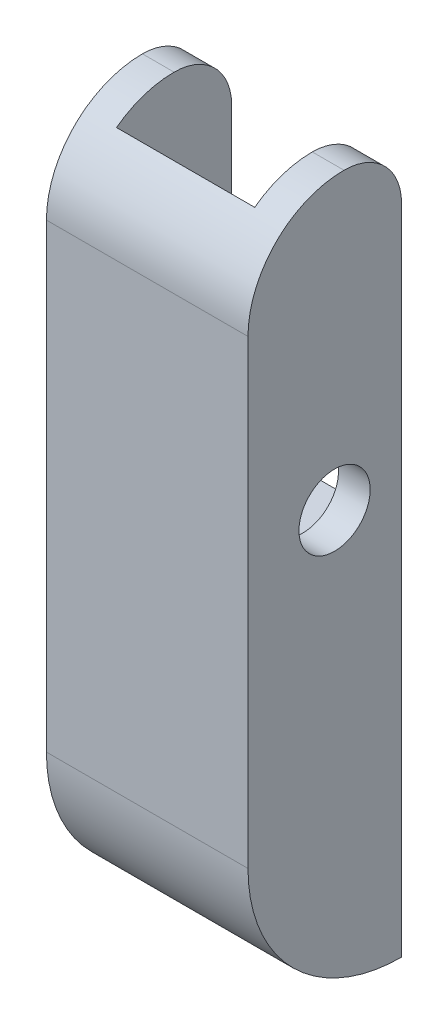
from build123d import *

# Parameters (mm, degrees)
SKETCH1_W               = 13.335
SKETCH1_H               = 46.99
BOSS_EXTRUDE1_DEPTH     = 10.16
FILLET5_R               = 3.81
SKETCH2_W               = 9.144
SKETCH2_H               = 22.352
CUT_EXTRUDE1_DEPTH      = 7.62
CUT_EXTRUDE2_DEPTH      = 50.890960354
CUT_EXTRUDE2_DEPTH_BACK = 50.890960354
SKETCH3_R               = 2.35585
FILLET4_R               = 6.35
FILLET6_R               = 10.16


# Some blends are built 0.0001 mm under size
with BuildPart() as part:
    # Sketch1 → Boss-Extrude1 (new body)
    with BuildSketch(Plane.XY):
        with Locations((6.6675, 23.495)):
            Rectangle(SKETCH1_W, SKETCH1_H)
    extrude(amount=BOSS_EXTRUDE1_DEPTH)

    # Fillet5
    fillet5_edges = [part.edges().sort_by_distance(p)[0] for p in [
        (6.6675, 46.99, 0),
    ]]
    fillet(fillet5_edges, radius=FILLET5_R)

    # Sketch2 → Cut-Extrude1 (cut)
    with BuildSketch(Plane(origin=(0, 0, 0), x_dir=(-1, 0, 0), z_dir=(0, 0, -1))):
        with Locations((-6.6675, 35.814)):
            Rectangle(SKETCH2_W, SKETCH2_H)
    extrude(amount=-CUT_EXTRUDE1_DEPTH, mode=Mode.SUBTRACT)

    # Sketch3 → Cut-Extrude2 (cut, two sides: drawn at the far end of the back side and taken through both)
    with BuildSketch(Plane.ZY.offset(-CUT_EXTRUDE2_DEPTH_BACK)):
        with Locations((4.4323, 27.8257)):
            Circle(SKETCH3_R)
    extrude(amount=CUT_EXTRUDE2_DEPTH + CUT_EXTRUDE2_DEPTH_BACK, mode=Mode.SUBTRACT)

    # Fillet4
    # the kernel refuses this fillet: 6.35 mm, written as the material it takes off along each edge
    with BuildSketch(Plane(origin=(29.21, 46.99, 10.16), x_dir=(0, 0, -1), z_dir=(-1, 0, 0))) as fillet4_piece_1:
        with BuildLine():
            CenterArc((FILLET4_R, FILLET4_R), FILLET4_R, 180, 90)
            Line((0, FILLET4_R), (0, 0))
            Line((0, 0), (FILLET4_R, 0))
        make_face()
    extrude(amount=45.085, mode=Mode.SUBTRACT)

    # Fillet6
    fillet6_edges = [part.edges().sort_by_distance(p)[0] for p in [
        (6.6675, 0, 10.16),
    ]]
    fillet(fillet6_edges, radius=FILLET6_R - 0.0001)  # a hair under: the kernel refuses the full size


solid = part.part
